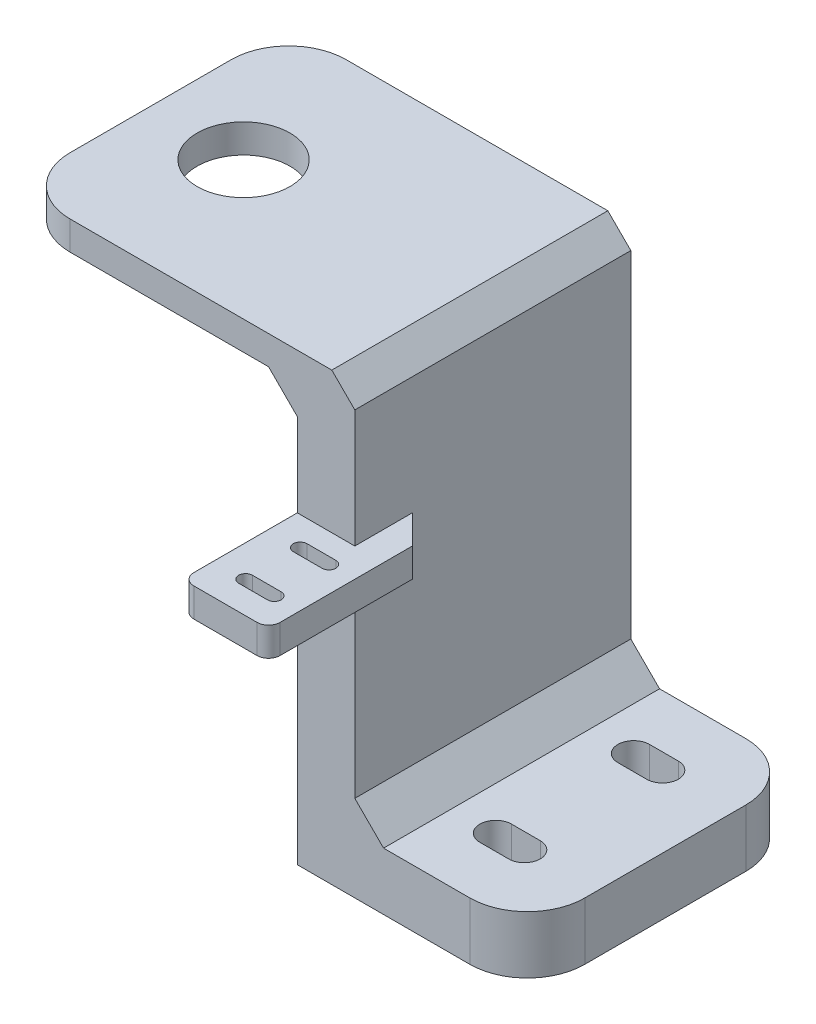
from build123d import *

# Parameters (mm, degrees)
SKETCH1_W                 = 59.5
SKETCH1_H                 = 48
BOSS_EXTRUDE1_DEPTH       = 5
SKETCH2_W                 = 10
SKETCH2_H                 = 48
BOSS_EXTRUDE2_DEPTH       = 72.5
SKETCH3_W                 = 48
SKETCH3_H                 = 10
BOSS_EXTRUDE3_DEPTH       = 30
FILLET1_R                 = 10
F_1_0MM_START             = -72.5
F_1_0MM_DOWEL_SLOT1_DEPTH = 10
FILLET2_R                 = 10
M6_CLEARANCE_HOLE1_D      = 16.15
CHAMFER1_SIZE             = 5
CHAMFER2_SIZE             = 4
SKETCH14_W                = 15
SKETCH14_H                = 5
BOSS_EXTRUDE4_DEPTH       = 20
CHAMFER3_SIZE             = 10
FILLET3_R                 = 2
M2_START                  = -24.5
M2_CLEARANCE_SLOT1_DEPTH  = 5


# Read off the part's stored shape, not the designer's step: Ø1.0mm Dowel Slot1, M2 Clearance Slot1
with BuildPart() as part:
    # Sketch1 → Boss-Extrude1 (new body)
    with BuildSketch(Plane(origin=(0, 0, 0), x_dir=(1, 0, 0), z_dir=(0, 1, 0))):
        with Locations((5.75, 0)):
            Rectangle(SKETCH1_W, SKETCH1_H)
    extrude(amount=BOSS_EXTRUDE1_DEPTH)

    # Sketch2 → Boss-Extrude2 (add)
    with BuildSketch(Plane.XZ):
        with Locations((30.5, 0)):
            Rectangle(SKETCH2_W, SKETCH2_H)
    extrude(amount=BOSS_EXTRUDE2_DEPTH)

    # Sketch3 → Boss-Extrude3 (add)
    with BuildSketch(Plane(origin=(35.5, 0, 0), x_dir=(0, 0, -1), z_dir=(1, 0, 0))):
        with Locations((0, -67.5)):
            Rectangle(SKETCH3_W, SKETCH3_H)
    extrude(amount=BOSS_EXTRUDE3_DEPTH)

    # Fillet1
    fillet1_edges = [part.edges().sort_by_distance(p)[0] for p in [
        (-24, 2.5, -24),
        (-24, 2.5, 24),
    ]]
    fillet(fillet1_edges, radius=FILLET1_R)

    # Ø1.0mm Dowel Slot1 outline → Ø1.0mm Dowel Slot1 (cut)
    with BuildSketch(Plane(origin=(0, 0, 0), x_dir=(1, 0, 0), z_dir=(0, 1, 0)).offset(F_1_0MM_START)):
        with BuildLine():
            Line((53, 14.75), (48, 14.75))
            ThreePointArc((48, 14.75), (45.25, 12), (48, 9.25))
            Line((48, 9.25), (53, 9.25))
            ThreePointArc((53, 9.25), (55.75, 12), (53, 14.75))
        make_face()
        with BuildLine():
            Line((53, -9.25), (48, -9.25))
            ThreePointArc((48, -9.25), (45.25, -12), (48, -14.75))
            Line((48, -14.75), (53, -14.75))
            ThreePointArc((53, -14.75), (55.75, -12), (53, -9.25))
        make_face()
    extrude(amount=F_1_0MM_DOWEL_SLOT1_DEPTH, mode=Mode.SUBTRACT)

    # Fillet2
    fillet2_edges = [part.edges().sort_by_distance(p)[0] for p in [
        (65.5, -67.5, 24),
        (65.5, -67.5, -24),
    ]]
    fillet(fillet2_edges, radius=FILLET2_R)

    # M6 Clearance Hole1 (through all)
    with Locations(Plane(origin=(0, 5, 0), x_dir=(1, 0, 0), z_dir=(0, 1, 0))):
        with Locations((-7.85, 0)):
            Hole(M6_CLEARANCE_HOLE1_D / 2)

    # Chamfer1
    chamfer1_edges = [part.edges().sort_by_distance(p)[0] for p in [
        (25.5, 0, 0),
        (35.5, -62.5, 0),
    ]]
    chamfer(chamfer1_edges, length=CHAMFER1_SIZE)

    # Chamfer2
    chamfer2_edges = [part.edges().sort_by_distance(p)[0] for p in [
        (35.5, 5, 0),
    ]]
    chamfer(chamfer2_edges, length=CHAMFER2_SIZE)

    # Sketch14 → Boss-Extrude4 (add)
    with BuildSketch(Plane.XY.offset(24)):
        with Locations((33, -22)):
            Rectangle(SKETCH14_W, SKETCH14_H)
    extrude(amount=BOSS_EXTRUDE4_DEPTH)

    # Chamfer3
    # the kernel refuses this chamfer: 10 mm, written as the material it adds along each edge
    with BuildSketch(Plane(origin=(35.5, -19.5, 24), x_dir=(-0.027495876610586317, 0, -0.9996219169112968), z_dir=(0, -1, 0))) as chamfer3_piece_1_section:
        Polygon((CHAMFER3_SIZE * 0.999621916911, CHAMFER3_SIZE * 0.0274958766106), (-CHAMFER3_SIZE * 0.0274958766106, CHAMFER3_SIZE * 0.999621916911), (0, 0), align=None)
    chamfer3_piece_1 = extrude(amount=5, mode=Mode.PRIVATE)
    chamfer3_piece_1 = split(chamfer3_piece_1, bisect_by=Plane(origin=(40.5, -22, 20.111111111), z_dir=(-1, 0, 0)), keep=Keep.TOP, mode=Mode.PRIVATE)
    add(chamfer3_piece_1)

    # Fillet3
    fillet3_edges = [part.edges().sort_by_distance(p)[0] for p in [
        (30.5, -24.5, 24),
        (25.5, -22, 44),
        (40.5, -22, 44),
        (35.5, -24.5, 19),
    ]]
    fillet(fillet3_edges, radius=FILLET3_R)

    # M2 Clearance Slot1 outline → M2 Clearance Slot1 (cut)
    with BuildSketch(Plane(origin=(0, 0, 0), x_dir=(1, 0, 0), z_dir=(0, 1, 0)).offset(M2_START)):
        with BuildLine():
            Line((31, -30.2), (36, -30.2))
            ThreePointArc((36, -30.2), (37.2, -29), (36, -27.8))
            Line((36, -27.8), (31, -27.8))
            ThreePointArc((31, -27.8), (29.8, -29), (31, -30.2))
        make_face()
        with BuildLine():
            Line((31, -39.7), (36, -39.7))
            ThreePointArc((36, -39.7), (37.2, -38.5), (36, -37.3))
            Line((36, -37.3), (31, -37.3))
            ThreePointArc((31, -37.3), (29.8, -38.5), (31, -39.7))
        make_face()
    extrude(amount=M2_CLEARANCE_SLOT1_DEPTH, mode=Mode.SUBTRACT)


solid = part.part
